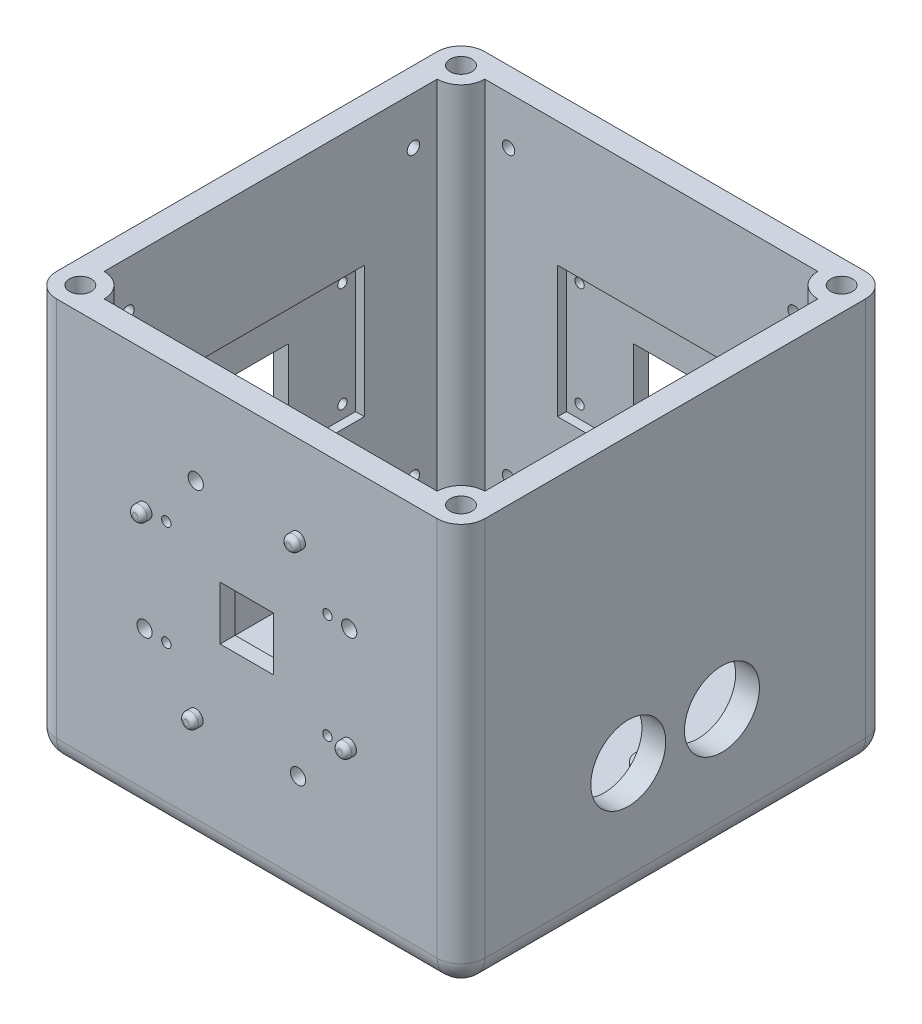
from build123d import *

# Parameters (mm, degrees)
SKETCH1_W                                  = 114.3
SKETCH1_H                                  = 114.3
BOSS_EXTRUDE1_DEPTH                        = 53.975
SHELL1_T                                   = -6.35
SKETCH3_W                                  = 6.35
SKETCH3_H                                  = 101.6
REVOLVE1_ANGLE                             = 90
MIRROR1_AT_THE_SECOND_PLANE_COPY_1_SKETC_W = 6.35
MIRROR1_AT_THE_SECOND_PLANE_COPY_1_SKETC_H = 101.6
MIRROR1_AT_THE_SECOND_PLANE_COPY_1_ANGLE   = 90
SKETCH16_W                                 = 14.2875
SKETCH16_H                                 = 14.2875
CUT_EXTRUDE1_DEPTH                         = 4
FILLET1_R                                  = 6.35
SKETCH22_R                                 = 2.92
CUT_EXTRUDE5_DEPTH                         = 5.007428571
MIRROR6_AT_THE_SECOND_PLANE_COPY_1_SKETC_R = 2.92
MIRROR6_AT_THE_SECOND_PLANE_COPY_1_DEPTH   = 5.007428571
SKETCH25_R                                 = 1.9685
BOSS_EXTRUDE2_DEPTH                        = 2.54
SKETCH25_3_R                               = 2.032
CUT_EXTRUDE6_DEPTH                         = 3.048
FILLET5_R                                  = 1.27
FILLET5_OF_MIRROR13_R                      = 1.27
FILLET5_OF_MIRROR13_AT_THE_SECOND_PLANE_R  = 1.27
SKETCH15_W                                 = 50
SKETCH15_H                                 = 35
CUT_EXTRUDE10_DEPTH                        = 2.35
CUT_EXTRUDE11_REACH                        = 141.788
BOSS_EXTRUDE3_DEPTH                        = 6.35
BOSS_EXTRUDE4_START                        = -47.625
BOSS_EXTRUDE4_OUTLINE_R                    = 2.2499955
BOSS_EXTRUDE4_DEPTH                        = 0.549999916
CUT_EXTRUDE14_DEPTH                        = 3.302
CUT_EXTRUDE15_REACH                        = 138.69
SKETCH43_R                                 = 10


# Read off the part's stored shape, not the designer's step: Boss-Extrude4
with BuildPart() as part:
    # Sketch1 → Boss-Extrude1 (new, symmetric)
    with BuildSketch(Plane(origin=(0, 0, 0), x_dir=(1, 0, 0), z_dir=(0, 1, 0))):
        Rectangle(SKETCH1_W, SKETCH1_H)
    extrude(amount=BOSS_EXTRUDE1_DEPTH, both=True)

    # Shell1
    shell1_openings = [part.faces().sort_by_distance(p)[0] for p in [
        (0, 53.975, 0),
    ]]
    offset(amount=SHELL1_T, openings=shell1_openings, kind=Kind.INTERSECTION)

    # Sketch3 → Revolve1 (revolve)
    with BuildSketch(Plane(origin=(-50.8, 0, 0), x_dir=(0, 0, -1), z_dir=(1, 0, 0))):
        with Locations((-47.625, 3.175)):
            Rectangle(SKETCH3_W, SKETCH3_H)
    revolve1 = revolve(axis=Axis((-50.8, 53.975, 50.8), (0, -1, 0)), revolution_arc=REVOLVE1_ANGLE)

    # Mirror1: Revolve1 across plane
    add(revolve1.mirror(Plane(origin=(0, 0, 0), x_dir=(0, 0, 1), z_dir=(1, 0, 0))))

    # Mirror1 at the second plane: Revolve1 across plane
    add(revolve1.mirror(Plane.XY))

    # Mirror1 at the second plane copy 1 sketc → Mirror1 at the second plane copy 1 (revolve)
    with BuildSketch(Plane.ZY.offset(-50.8)):
        with Locations((-47.625, 3.175)):
            Rectangle(MIRROR1_AT_THE_SECOND_PLANE_COPY_1_SKETC_W, MIRROR1_AT_THE_SECOND_PLANE_COPY_1_SKETC_H)
    revolve(axis=Axis((50.8, 53.975, -50.8), (0, -1, 0)), revolution_arc=MIRROR1_AT_THE_SECOND_PLANE_COPY_1_ANGLE)

    # Sketch16 → Cut-Extrude1 (cut)
    with BuildSketch(Plane.ZY.offset(57.15)):
        with Locations((0, 3.175)):
            Rectangle(SKETCH16_W, SKETCH16_H)
    cut_extrude1 = extrude(amount=-CUT_EXTRUDE1_DEPTH, mode=Mode.SUBTRACT)

    # Mirror4: Cut-Extrude1 across plane
    add(cut_extrude1.mirror(Plane(origin=(0, 0, 0), x_dir=(0.7071067811865465, 0, 0.7071067811865486), z_dir=(-0.7071067811865488, 0, 0.7071067811865464))), mode=Mode.SUBTRACT)

    # Mirror4 at the second plane: Cut-Extrude1 across plane
    add(cut_extrude1.mirror(Plane(origin=(0, 0, 0), x_dir=(-0.7071067811865465, 0, 0.7071067811865486), z_dir=(0.7071067811865488, 0, 0.7071067811865464))), mode=Mode.SUBTRACT)

    # Fillet1
    fillet1_edges = [part.edges().sort_by_distance(p)[0] for p in [
        (0, -53.975, -57.15),
        (57.15, -53.975, 0),
        (0, -53.975, 57.15),
        (-57.15, -53.975, 0),
        (-57.15, 0, -57.15),
        (57.15, 0, -57.15),
        (57.15, 0, 57.15),
        (-57.15, 0, 57.15),
    ]]
    fillet(fillet1_edges, radius=FILLET1_R)

    # Sketch22 → Cut-Extrude5 (cut)
    with BuildSketch(Plane(origin=(0, 53.975, 0), x_dir=(1, 0, 0), z_dir=(0, 1, 0))):
        with Locations(Location((-50.8, -50.8, 0), (0, 0, 270))):
            Circle(SKETCH22_R)
    cut_extrude5 = extrude(amount=-CUT_EXTRUDE5_DEPTH, mode=Mode.SUBTRACT)

    # Mirror6: Cut-Extrude5 across plane
    add(cut_extrude5.mirror(Plane.XY), mode=Mode.SUBTRACT)

    # Mirror6 at the second plane: Cut-Extrude5 across plane
    add(cut_extrude5.mirror(Plane(origin=(0, 0, 0), x_dir=(0, 0, 1), z_dir=(1, 0, 0))), mode=Mode.SUBTRACT)

    # Mirror6 at the second plane copy 1 sketc → Mirror6 at the second plane copy 1 (cut)
    with BuildSketch(Plane(origin=(0, 53.975, 0), x_dir=(-1, 0, 0), z_dir=(0, 1, 0))):
        with Locations(Location((-50.8, -50.8, 0), (0, 0, 270))):
            Circle(MIRROR6_AT_THE_SECOND_PLANE_COPY_1_SKETC_R)
    extrude(amount=-MIRROR6_AT_THE_SECOND_PLANE_COPY_1_DEPTH, mode=Mode.SUBTRACT)

    # Sketch25 → Boss-Extrude2 (add)
    with BuildSketch(Plane.XY.offset(57.15)):
        with Locations(Location((-27.305, 16.8275, 0), (0, 0, 180))):
            Circle(SKETCH25_R)
        with Locations(Location((13.6525, 30.48, 0), (0, 0, 180))):
            Circle(SKETCH25_R)
        with Locations(Location((27.305, -10.4775, 0), (0, 0, 180))):
            Circle(SKETCH25_R)
        with Locations(Location((-13.6525, -24.13, 0), (0, 0, 180))):
            Circle(SKETCH25_R)
    boss_extrude2 = extrude(amount=BOSS_EXTRUDE2_DEPTH)

    # Sketch25<3> → Cut-Extrude6 (cut)
    with BuildSketch(Plane.XY.offset(57.15)):
        with Locations((-27.305, -10.4775)):
            Circle(SKETCH25_3_R)
        with Locations((-13.6525, 30.48)):
            Circle(SKETCH25_3_R)
        with Locations((27.305, 16.8275)):
            Circle(SKETCH25_3_R)
        with Locations((13.6525, -24.13)):
            Circle(SKETCH25_3_R)
    cut_extrude6 = extrude(amount=-CUT_EXTRUDE6_DEPTH, mode=Mode.SUBTRACT)

    # Fillet5
    fillet5_edges = [part.edges().sort_by_distance(p)[0] for p in [
        (15.621, 30.48, 59.69),
        (29.2735, -10.4775, 59.69),
        (-11.684, -24.13, 59.69),
        (-25.3365, 16.8275, 59.69),
    ]]
    fillet(fillet5_edges, radius=FILLET5_R)

    # Mirror13: Boss-Extrude2 across plane
    add(boss_extrude2.mirror(Plane(origin=(0, 0, 0), x_dir=(-0.7071067811865465, 0, 0.7071067811865486), z_dir=(0.7071067811865488, 0, 0.7071067811865464))))

    # Fillet5 of Mirror13
    fillet5_of_mirror13_edges = [part.edges().sort_by_distance(p)[0] for p in [
        (-59.69, 30.48, -15.621),
        (-59.69, -10.4775, -29.2735),
        (-59.69, -24.13, 11.684),
        (-59.69, 16.8275, 25.3365),
    ]]
    fillet(fillet5_of_mirror13_edges, radius=FILLET5_OF_MIRROR13_R)

    # Mirror13 at the second plane: Boss-Extrude2 across plane
    add(boss_extrude2.mirror(Plane.XY))

    # Fillet5 of Mirror13 at the second plane
    fillet5_of_mirror13_at_the_second_plane_edges = [part.edges().sort_by_distance(p)[0] for p in [
        (15.621, 30.48, -59.69),
        (29.2735, -10.4775, -59.69),
        (-11.684, -24.13, -59.69),
        (-25.3365, 16.8275, -59.69),
    ]]
    fillet(fillet5_of_mirror13_at_the_second_plane_edges, radius=FILLET5_OF_MIRROR13_AT_THE_SECOND_PLANE_R)

    # Mirror14: Cut-Extrude6 across plane
    add(cut_extrude6.mirror(Plane(origin=(0, 0, 0), x_dir=(-0.7071067811865465, 0, 0.7071067811865486), z_dir=(0.7071067811865488, 0, 0.7071067811865464))), mode=Mode.SUBTRACT)

    # Mirror14 at the second plane: Cut-Extrude6 across plane
    add(cut_extrude6.mirror(Plane.XY), mode=Mode.SUBTRACT)

    # Sketch15 → Cut-Extrude10 (cut)
    with BuildSketch(Plane(origin=(-50.8, 0, 0), x_dir=(0, 0, -1), z_dir=(1, 0, 0))):
        with Locations((0, 3.175)):
            Rectangle(SKETCH15_W, SKETCH15_H)
    cut_extrude10 = extrude(amount=-CUT_EXTRUDE10_DEPTH, mode=Mode.SUBTRACT)

    # Sketch34 → Cut-Extrude11 (cut, up to next)
    with BuildSketch(Plane.ZY.offset(57.15), mode=Mode.PRIVATE) as cut_extrude11_sk1:
        with BuildLine():
            Line((-21.5, 15.925), (-21.5, 17.175))
            Line((-21.5, 17.175), (-20.25, 17.175))
            ThreePointArc((-20.25, 17.175), (-22.383883476, 18.058883476), (-21.5, 15.925))
        make_face()
    cut_extrude11_tool1 = extrude(cut_extrude11_sk1.sketch, amount=-CUT_EXTRUDE11_REACH, mode=Mode.PRIVATE) & part.part
    # Sketch34 → Cut-Extrude11 (cut, up to next)
    with BuildSketch(Plane.ZY.offset(57.15), mode=Mode.PRIVATE) as cut_extrude11_sk2:
        with BuildLine():
            Line((-20.25, 17.175), (-21.5, 17.175))
            Line((-21.5, 17.175), (-21.5, 15.925))
            ThreePointArc((-21.5, 15.925), (-20.616116524, 16.291116524), (-20.25, 17.175))
        make_face()
    cut_extrude11_tool2 = extrude(cut_extrude11_sk2.sketch, amount=-CUT_EXTRUDE11_REACH, mode=Mode.PRIVATE) & part.part
    # Sketch34 → Cut-Extrude11 (cut, up to next)
    with BuildSketch(Plane.ZY.offset(57.15), mode=Mode.PRIVATE) as cut_extrude11_sk3:
        with BuildLine():
            Line((-21.5, 15.925), (-21.5, 17.175))
            Line((-21.5, 17.175), (-20.25, 17.175))
            ThreePointArc((-20.25, 17.175), (-22.383883476, 18.058883476), (-21.5, 15.925))
        make_face()
    cut_extrude11_tool3 = extrude(cut_extrude11_sk3.sketch, amount=-CUT_EXTRUDE11_REACH, mode=Mode.PRIVATE) & part.part
    # Sketch34 → Cut-Extrude11 (cut, up to next)
    with BuildSketch(Plane.ZY.offset(57.15), mode=Mode.PRIVATE) as cut_extrude11_sk4:
        with BuildLine():
            Line((-20.25, 17.175), (-21.5, 17.175))
            Line((-21.5, 17.175), (-21.5, 15.925))
            ThreePointArc((-21.5, 15.925), (-20.616116524, 16.291116524), (-20.25, 17.175))
        make_face()
    cut_extrude11_tool4 = extrude(cut_extrude11_sk4.sketch, amount=-CUT_EXTRUDE11_REACH, mode=Mode.PRIVATE) & part.part
    # Sketch34 → Cut-Extrude11 (cut, up to next)
    with BuildSketch(Plane.ZY.offset(57.15), mode=Mode.PRIVATE) as cut_extrude11_sk5:
        with BuildLine():
            ThreePointArc((22.75, 17.175), (21.5, 18.425), (20.25, 17.175))
            Line((20.25, 17.175), (21.5, 17.175))
            Line((21.5, 17.175), (21.5, 15.925))
            ThreePointArc((21.5, 15.925), (22.383883476, 16.291116524), (22.75, 17.175))
        make_face()
    cut_extrude11_tool5 = extrude(cut_extrude11_sk5.sketch, amount=-CUT_EXTRUDE11_REACH, mode=Mode.PRIVATE) & part.part
    # Sketch34 → Cut-Extrude11 (cut, up to next)
    with BuildSketch(Plane.ZY.offset(57.15), mode=Mode.PRIVATE) as cut_extrude11_sk6:
        with BuildLine():
            Line((21.5, 17.175), (20.25, 17.175))
            ThreePointArc((20.25, 17.175), (20.616116524, 16.291116524), (21.5, 15.925))
            Line((21.5, 15.925), (21.5, 17.175))
        make_face()
    cut_extrude11_tool6 = extrude(cut_extrude11_sk6.sketch, amount=-CUT_EXTRUDE11_REACH, mode=Mode.PRIVATE) & part.part
    # Sketch34 → Cut-Extrude11 (cut, up to next)
    with BuildSketch(Plane.ZY.offset(57.15), mode=Mode.PRIVATE) as cut_extrude11_sk7:
        with BuildLine():
            ThreePointArc((22.75, 17.175), (21.5, 18.425), (20.25, 17.175))
            Line((20.25, 17.175), (21.5, 17.175))
            Line((21.5, 17.175), (21.5, 15.925))
            ThreePointArc((21.5, 15.925), (22.383883476, 16.291116524), (22.75, 17.175))
        make_face()
    cut_extrude11_tool7 = extrude(cut_extrude11_sk7.sketch, amount=-CUT_EXTRUDE11_REACH, mode=Mode.PRIVATE) & part.part
    # Sketch34 → Cut-Extrude11 (cut, up to next)
    with BuildSketch(Plane.ZY.offset(57.15), mode=Mode.PRIVATE) as cut_extrude11_sk8:
        with BuildLine():
            Line((21.5, 17.175), (20.25, 17.175))
            ThreePointArc((20.25, 17.175), (20.616116524, 16.291116524), (21.5, 15.925))
            Line((21.5, 15.925), (21.5, 17.175))
        make_face()
    cut_extrude11_tool8 = extrude(cut_extrude11_sk8.sketch, amount=-CUT_EXTRUDE11_REACH, mode=Mode.PRIVATE) & part.part
    # Sketch34 → Cut-Extrude11 (cut, up to next)
    with BuildSketch(Plane.ZY.offset(57.15), mode=Mode.PRIVATE) as cut_extrude11_sk9:
        with BuildLine():
            ThreePointArc((22.75, -10.825), (22.383883476, -9.941116524), (21.5, -9.575))
            Line((21.5, -9.575), (21.5, -10.825))
            Line((21.5, -10.825), (20.25, -10.825))
            ThreePointArc((20.25, -10.825), (21.5, -12.075), (22.75, -10.825))
        make_face()
    cut_extrude11_tool9 = extrude(cut_extrude11_sk9.sketch, amount=-CUT_EXTRUDE11_REACH, mode=Mode.PRIVATE) & part.part
    # Sketch34 → Cut-Extrude11 (cut, up to next)
    with BuildSketch(Plane.ZY.offset(57.15), mode=Mode.PRIVATE) as cut_extrude11_sk10:
        with BuildLine():
            Line((21.5, -10.825), (21.5, -9.575))
            ThreePointArc((21.5, -9.575), (20.616116524, -9.941116524), (20.25, -10.825))
            Line((20.25, -10.825), (21.5, -10.825))
        make_face()
    cut_extrude11_tool10 = extrude(cut_extrude11_sk10.sketch, amount=-CUT_EXTRUDE11_REACH, mode=Mode.PRIVATE) & part.part
    # Sketch34 → Cut-Extrude11 (cut, up to next)
    with BuildSketch(Plane.ZY.offset(57.15), mode=Mode.PRIVATE) as cut_extrude11_sk11:
        with BuildLine():
            ThreePointArc((22.75, -10.825), (22.383883476, -9.941116524), (21.5, -9.575))
            Line((21.5, -9.575), (21.5, -10.825))
            Line((21.5, -10.825), (20.25, -10.825))
            ThreePointArc((20.25, -10.825), (21.5, -12.075), (22.75, -10.825))
        make_face()
    cut_extrude11_tool11 = extrude(cut_extrude11_sk11.sketch, amount=-CUT_EXTRUDE11_REACH, mode=Mode.PRIVATE) & part.part
    # Sketch34 → Cut-Extrude11 (cut, up to next)
    with BuildSketch(Plane.ZY.offset(57.15), mode=Mode.PRIVATE) as cut_extrude11_sk12:
        with BuildLine():
            Line((21.5, -10.825), (21.5, -9.575))
            ThreePointArc((21.5, -9.575), (20.616116524, -9.941116524), (20.25, -10.825))
            Line((20.25, -10.825), (21.5, -10.825))
        make_face()
    cut_extrude11_tool12 = extrude(cut_extrude11_sk12.sketch, amount=-CUT_EXTRUDE11_REACH, mode=Mode.PRIVATE) & part.part
    # Sketch34 → Cut-Extrude11 (cut, up to next)
    with BuildSketch(Plane.ZY.offset(57.15), mode=Mode.PRIVATE) as cut_extrude11_sk13:
        with BuildLine():
            ThreePointArc((-20.25, -10.825), (-20.616116524, -9.941116524), (-21.5, -9.575))
            Line((-21.5, -9.575), (-21.5, -10.825))
            Line((-21.5, -10.825), (-20.25, -10.825))
        make_face()
    cut_extrude11_tool13 = extrude(cut_extrude11_sk13.sketch, amount=-CUT_EXTRUDE11_REACH, mode=Mode.PRIVATE) & part.part
    # Sketch34 → Cut-Extrude11 (cut, up to next)
    with BuildSketch(Plane.ZY.offset(57.15), mode=Mode.PRIVATE) as cut_extrude11_sk14:
        with BuildLine():
            Line((-21.5, -10.825), (-21.5, -9.575))
            ThreePointArc((-21.5, -9.575), (-22.383883476, -11.708883476), (-20.25, -10.825))
            Line((-20.25, -10.825), (-21.5, -10.825))
        make_face()
    cut_extrude11_tool14 = extrude(cut_extrude11_sk14.sketch, amount=-CUT_EXTRUDE11_REACH, mode=Mode.PRIVATE) & part.part
    # Sketch34 → Cut-Extrude11 (cut, up to next)
    with BuildSketch(Plane.ZY.offset(57.15), mode=Mode.PRIVATE) as cut_extrude11_sk15:
        with BuildLine():
            ThreePointArc((-20.25, -10.825), (-20.616116524, -9.941116524), (-21.5, -9.575))
            Line((-21.5, -9.575), (-21.5, -10.825))
            Line((-21.5, -10.825), (-20.25, -10.825))
        make_face()
    cut_extrude11_tool15 = extrude(cut_extrude11_sk15.sketch, amount=-CUT_EXTRUDE11_REACH, mode=Mode.PRIVATE) & part.part
    # Sketch34 → Cut-Extrude11 (cut, up to next)
    with BuildSketch(Plane.ZY.offset(57.15), mode=Mode.PRIVATE) as cut_extrude11_sk16:
        with BuildLine():
            Line((-21.5, -10.825), (-21.5, -9.575))
            ThreePointArc((-21.5, -9.575), (-22.383883476, -11.708883476), (-20.25, -10.825))
            Line((-20.25, -10.825), (-21.5, -10.825))
        make_face()
    cut_extrude11_tool16 = extrude(cut_extrude11_sk16.sketch, amount=-CUT_EXTRUDE11_REACH, mode=Mode.PRIVATE) & part.part
    cut_extrude11_1 = cut_extrude11_tool1.solids().sort_by_distance((-57.15, 17.351839, -21.676839))[0]
    add(cut_extrude11_1, mode=Mode.SUBTRACT)
    cut_extrude11_2 = cut_extrude11_tool2.solids().sort_by_distance((-57.15, 16.644484, -20.969484))[0]
    add(cut_extrude11_2, mode=Mode.SUBTRACT)
    cut_extrude11_3 = cut_extrude11_tool3.solids().sort_by_distance((-57.15, 17.351839, -21.676839))[0]
    add(cut_extrude11_3, mode=Mode.SUBTRACT)
    cut_extrude11_4 = cut_extrude11_tool4.solids().sort_by_distance((-57.15, 16.644484, -20.969484))[0]
    add(cut_extrude11_4, mode=Mode.SUBTRACT)
    cut_extrude11_5 = cut_extrude11_tool5.solids().sort_by_distance((-57.15, 17.351839, 21.676839))[0]
    add(cut_extrude11_5, mode=Mode.SUBTRACT)
    cut_extrude11_6 = cut_extrude11_tool6.solids().sort_by_distance((-57.15, 16.644484, 20.969484))[0]
    add(cut_extrude11_6, mode=Mode.SUBTRACT)
    cut_extrude11_7 = cut_extrude11_tool7.solids().sort_by_distance((-57.15, 17.351839, 21.676839))[0]
    add(cut_extrude11_7, mode=Mode.SUBTRACT)
    cut_extrude11_8 = cut_extrude11_tool8.solids().sort_by_distance((-57.15, 16.644484, 20.969484))[0]
    add(cut_extrude11_8, mode=Mode.SUBTRACT)
    cut_extrude11_9 = cut_extrude11_tool9.solids().sort_by_distance((-57.15, -11.001839, 21.676839))[0]
    add(cut_extrude11_9, mode=Mode.SUBTRACT)
    cut_extrude11_10 = cut_extrude11_tool10.solids().sort_by_distance((-57.15, -10.294484, 20.969484))[0]
    add(cut_extrude11_10, mode=Mode.SUBTRACT)
    cut_extrude11_11 = cut_extrude11_tool11.solids().sort_by_distance((-57.15, -11.001839, 21.676839))[0]
    add(cut_extrude11_11, mode=Mode.SUBTRACT)
    cut_extrude11_12 = cut_extrude11_tool12.solids().sort_by_distance((-57.15, -10.294484, 20.969484))[0]
    add(cut_extrude11_12, mode=Mode.SUBTRACT)
    cut_extrude11_13 = cut_extrude11_tool13.solids().sort_by_distance((-57.15, -10.294484, -20.969484))[0]
    add(cut_extrude11_13, mode=Mode.SUBTRACT)
    cut_extrude11_14 = cut_extrude11_tool14.solids().sort_by_distance((-57.15, -11.001839, -21.676839))[0]
    add(cut_extrude11_14, mode=Mode.SUBTRACT)
    cut_extrude11_15 = cut_extrude11_tool15.solids().sort_by_distance((-57.15, -10.294484, -20.969484))[0]
    add(cut_extrude11_15, mode=Mode.SUBTRACT)
    cut_extrude11_16 = cut_extrude11_tool16.solids().sort_by_distance((-57.15, -11.001839, -21.676839))[0]
    add(cut_extrude11_16, mode=Mode.SUBTRACT)
    cut_extrude11 = cut_extrude11_1 + cut_extrude11_2 + cut_extrude11_3 + cut_extrude11_4 + cut_extrude11_5 + cut_extrude11_6 + cut_extrude11_7 + cut_extrude11_8 + cut_extrude11_9 + cut_extrude11_10 + cut_extrude11_11 + cut_extrude11_12 + cut_extrude11_13 + cut_extrude11_14 + cut_extrude11_15 + cut_extrude11_16  # Cut-Extrude11 as one shape, for the pattern or mirror that repeats it

    # Mirror15: Cut-Extrude10, Cut-Extrude11 across plane
    add(cut_extrude10.mirror(Plane(origin=(0, 0, 0), x_dir=(-0.7071067811865465, 0, 0.7071067811865486), z_dir=(0.7071067811865488, 0, 0.7071067811865464))), mode=Mode.SUBTRACT)
    add(cut_extrude11.mirror(Plane(origin=(0, 0, 0), x_dir=(-0.7071067811865465, 0, 0.7071067811865486), z_dir=(0.7071067811865488, 0, 0.7071067811865464))), mode=Mode.SUBTRACT)

    # Mirror15 at the second plane: Cut-Extrude10, Cut-Extrude11 across plane
    add(cut_extrude10.mirror(Plane(origin=(0, 0, 0), x_dir=(0.7071067811865465, 0, 0.7071067811865486), z_dir=(-0.7071067811865488, 0, 0.7071067811865464))), mode=Mode.SUBTRACT)
    add(cut_extrude11.mirror(Plane(origin=(0, 0, 0), x_dir=(0.7071067811865465, 0, 0.7071067811865486), z_dir=(-0.7071067811865488, 0, 0.7071067811865464))), mode=Mode.SUBTRACT)

    # Sketch40 → Boss-Extrude3 (add)
    with BuildSketch(Plane(origin=(0, -47.625, 0), x_dir=(1, 0, 0), z_dir=(0, 1, 0))):
        with BuildLine():
            ThreePointArc((14.55, 8.5000045), (12.959012924, 12.340987076), (16.7999955, 10.75))
            Line((16.7999955, 10.75), (19.050000017, 10.75))
            ThreePointArc((19.050000017, 10.75), (11.368019473, 13.931980527), (14.55, 6.249999983))
            Line((14.55, 6.249999983), (14.55, 8.5000045))
        make_face()
        with BuildLine():
            Line((19.050000017, 10.75), (16.7999955, 10.75))
            ThreePointArc((16.7999955, 10.75), (16.140987076, 9.159012924), (14.55, 8.5000045))
            Line((14.55, 8.5000045), (14.55, 6.249999983))
            ThreePointArc((14.55, 6.249999983), (17.731980527, 7.568019473), (19.050000017, 10.75))
        make_face()
        with BuildLine():
            ThreePointArc((45.050000017, 10.75), (40.55, 15.250000017), (36.049999983, 10.75))
            Line((36.049999983, 10.75), (38.3000045, 10.75))
            ThreePointArc((38.3000045, 10.75), (40.55, 12.9999955), (42.7999955, 10.75))
            ThreePointArc((42.7999955, 10.75), (42.140987076, 9.159012924), (40.55, 8.5000045))
            Line((40.55, 8.5000045), (40.55, 6.249999983))
            ThreePointArc((40.55, 6.249999983), (43.731980527, 7.568019473), (45.050000017, 10.75))
        make_face()
        with BuildLine():
            Line((38.3000045, 10.75), (36.049999983, 10.75))
            ThreePointArc((36.049999983, 10.75), (37.368019473, 7.568019473), (40.55, 6.249999983))
            Line((40.55, 6.249999983), (40.55, 8.5000045))
            ThreePointArc((40.55, 8.5000045), (38.959012924, 9.159012924), (38.3000045, 10.75))
        make_face()
        with BuildLine():
            ThreePointArc((45.050000017, -10.75), (43.731980527, -7.568019473), (40.55, -6.249999983))
            Line((40.55, -6.249999983), (40.55, -8.5000045))
            ThreePointArc((40.55, -8.5000045), (42.140987076, -9.159012924), (42.7999955, -10.75))
            ThreePointArc((42.7999955, -10.75), (40.55, -12.9999955), (38.3000045, -10.75))
            Line((38.3000045, -10.75), (36.049999983, -10.75))
            ThreePointArc((36.049999983, -10.75), (40.55, -15.250000017), (45.050000017, -10.75))
        make_face()
        with BuildLine():
            Line((40.55, -8.5000045), (40.55, -6.249999983))
            ThreePointArc((40.55, -6.249999983), (37.368019473, -7.568019473), (36.049999983, -10.75))
            Line((36.049999983, -10.75), (38.3000045, -10.75))
            ThreePointArc((38.3000045, -10.75), (38.959012924, -9.159012924), (40.55, -8.5000045))
        make_face()
        with BuildLine():
            ThreePointArc((19.050000017, -10.75), (17.731980527, -7.568019473), (14.55, -6.249999983))
            Line((14.55, -6.249999983), (14.55, -8.5000045))
            ThreePointArc((14.55, -8.5000045), (16.140987076, -9.159012924), (16.7999955, -10.75))
            Line((16.7999955, -10.75), (19.050000017, -10.75))
        make_face()
        with BuildLine():
            Line((14.55, -8.5000045), (14.55, -6.249999983))
            ThreePointArc((14.55, -6.249999983), (11.368019473, -13.931980527), (19.050000017, -10.75))
            Line((19.050000017, -10.75), (16.7999955, -10.75))
            ThreePointArc((16.7999955, -10.75), (12.959012924, -12.340987076), (14.55, -8.5000045))
        make_face()
    extrude(amount=BOSS_EXTRUDE3_DEPTH)

    # Boss-Extrude4 outline → Boss-Extrude4 (add)
    with BuildSketch(Plane(origin=(0, 0, 0), x_dir=(1, 0, 0), z_dir=(0, 1, 0)).offset(BOSS_EXTRUDE4_START)):
        with Locations((14.55, 10.75)):
            Circle(BOSS_EXTRUDE4_OUTLINE_R)
        with Locations((40.55, 10.75)):
            Circle(BOSS_EXTRUDE4_OUTLINE_R)
        with Locations((40.55, -10.75)):
            Circle(BOSS_EXTRUDE4_OUTLINE_R)
        with Locations((14.55, -10.75)):
            Circle(BOSS_EXTRUDE4_OUTLINE_R)
    extrude(amount=BOSS_EXTRUDE4_DEPTH)

    # Sketch41 → Cut-Extrude14 (cut)
    with BuildSketch(Plane(origin=(-50.8, 0, 0), x_dir=(0, 0, -1), z_dir=(1, 0, 0))):
        with BuildLine():
            Line((-38.1, 39.624), (-38.1, 41.275))
            Line((-38.1, 41.275), (-36.449, 41.275))
            ThreePointArc((-36.449, 41.275), (-39.267433296, 42.442433296), (-38.1, 39.624))
        make_face()
        with BuildLine():
            Line((-36.449, 41.275), (-38.1, 41.275))
            Line((-38.1, 41.275), (-38.1, 39.624))
            ThreePointArc((-38.1, 39.624), (-36.932566704, 40.107566704), (-36.449, 41.275))
        make_face()
        with BuildLine():
            ThreePointArc((39.751, 41.275), (38.1, 42.926), (36.449, 41.275))
            Line((36.449, 41.275), (38.1, 41.275))
            Line((38.1, 41.275), (38.1, 39.624))
            ThreePointArc((38.1, 39.624), (39.267433296, 40.107566704), (39.751, 41.275))
        make_face()
        with BuildLine():
            Line((38.1, 41.275), (36.449, 41.275))
            ThreePointArc((36.449, 41.275), (36.932566704, 40.107566704), (38.1, 39.624))
            Line((38.1, 39.624), (38.1, 41.275))
        make_face()
        with BuildLine():
            ThreePointArc((39.751, -34.925), (39.267433296, -33.757566704), (38.1, -33.274))
            Line((38.1, -33.274), (38.1, -34.925))
            Line((38.1, -34.925), (36.449, -34.925))
            ThreePointArc((36.449, -34.925), (38.1, -36.576), (39.751, -34.925))
        make_face()
        with BuildLine():
            Line((38.1, -34.925), (38.1, -33.274))
            ThreePointArc((38.1, -33.274), (36.932566704, -33.757566704), (36.449, -34.925))
            Line((36.449, -34.925), (38.1, -34.925))
        make_face()
        with BuildLine():
            ThreePointArc((-36.449, -34.925), (-36.932566704, -33.757566704), (-38.1, -33.274))
            Line((-38.1, -33.274), (-38.1, -34.925))
            Line((-38.1, -34.925), (-36.449, -34.925))
        make_face()
        with BuildLine():
            Line((-38.1, -34.925), (-38.1, -33.274))
            ThreePointArc((-38.1, -33.274), (-39.267433296, -36.092433296), (-36.449, -34.925))
            Line((-36.449, -34.925), (-38.1, -34.925))
        make_face()
    cut_extrude14 = extrude(amount=-CUT_EXTRUDE14_DEPTH, mode=Mode.SUBTRACT)

    # Mirror16: Cut-Extrude14 across plane
    add(cut_extrude14.mirror(Plane(origin=(0, 0, 0), x_dir=(0.7071067811865465, 0, 0.7071067811865486), z_dir=(-0.7071067811865488, 0, 0.7071067811865464))), mode=Mode.SUBTRACT)

    # Mirror16 at the second plane: Cut-Extrude14 across plane
    add(cut_extrude14.mirror(Plane(origin=(0, 0, 0), x_dir=(-0.7071067811865465, 0, 0.7071067811865486), z_dir=(0.7071067811865488, 0, 0.7071067811865464))), mode=Mode.SUBTRACT)

    # Sketch43 → Cut-Extrude15 (cut, up to next)
    with BuildSketch(Plane.ZY.offset(-50.8), mode=Mode.PRIVATE) as cut_extrude15_sk1:
        with Locations((-12.5, -21.675)):
            Circle(SKETCH43_R)
    cut_extrude15_tool1 = extrude(cut_extrude15_sk1.sketch, amount=-CUT_EXTRUDE15_REACH, mode=Mode.PRIVATE) & part.part
    # Sketch43 → Cut-Extrude15 (cut, up to next)
    with BuildSketch(Plane.ZY.offset(-50.8), mode=Mode.PRIVATE) as cut_extrude15_sk2:
        with Locations((12.5, -21.675)):
            Circle(SKETCH43_R)
    cut_extrude15_tool2 = extrude(cut_extrude15_sk2.sketch, amount=-CUT_EXTRUDE15_REACH, mode=Mode.PRIVATE) & part.part
    # Sketch43 → Cut-Extrude15 (cut, up to next)
    with BuildSketch(Plane.ZY.offset(-50.8), mode=Mode.PRIVATE) as cut_extrude15_sk3:
        with Locations((-12.5, -21.675)):
            Circle(SKETCH43_R)
    cut_extrude15_tool3 = extrude(cut_extrude15_sk3.sketch, amount=-CUT_EXTRUDE15_REACH, mode=Mode.PRIVATE) & part.part
    add(cut_extrude15_tool1.solids().sort_by_distance((50.8, -21.675, -12.5))[0], mode=Mode.SUBTRACT)
    add(cut_extrude15_tool2.solids().sort_by_distance((50.8, -21.675, 12.5))[0], mode=Mode.SUBTRACT)
    add(cut_extrude15_tool3.solids().sort_by_distance((50.8, -21.675, -12.5))[0], mode=Mode.SUBTRACT)


solid = part.part
